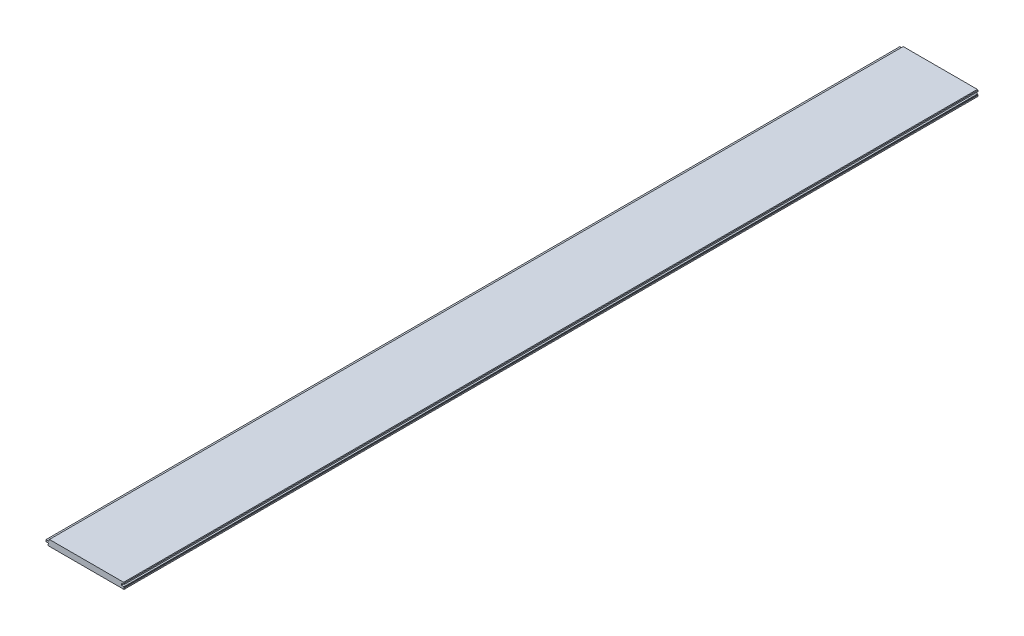
from build123d import *

# Parameters (mm, degrees)
BOSS_EXTRUDE1_DEPTH = 1066.8


with BuildPart() as part:
    # Sketch1 → Boss-Extrude1 (new, symmetric)
    with BuildSketch(Plane.XY):
        Polygon((-93.13545, 6.2865), (-93.13545, 2.9845), (-100.37445, 2.9845), (-100.37445, -1.5875), (-94.53245, -1.5875), (-94.53245, -3.1115), (-95.16745, -3.7465), (-95.16745, -6.9215), (-94.53245, -7.5565), (94.53245, -7.5565), (95.16745, -6.9215), (95.16745, -3.7465), (94.53245, -3.1115), (94.53245, -1.4986), (87.91575, -1.4986), (87.91575, 3.1242), (94.83725, 3.1242), (94.83725, 6.2865), (93.56725, 7.5565), (-91.86545, 7.5565), align=None)
    extrude(amount=BOSS_EXTRUDE1_DEPTH, both=True)


solid = part.part
